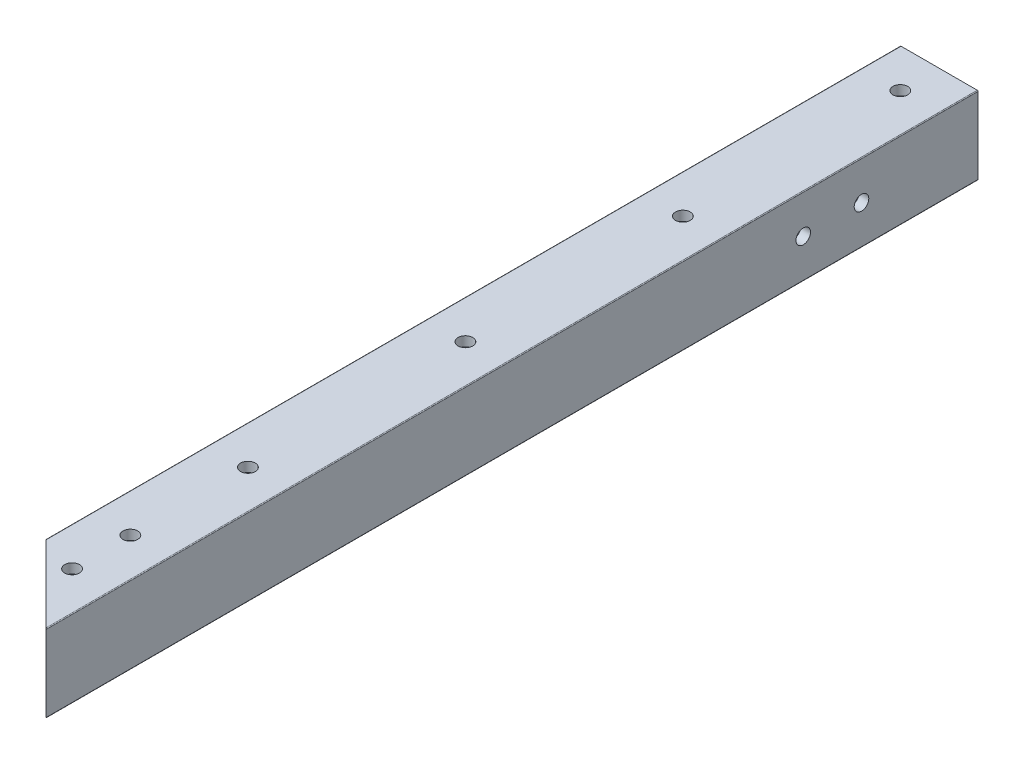
from build123d import *

# Parameters (mm, degrees)
CUT_EXTRUDE1_START = 1524
CUT_EXTRUDE1_DEPTH = 304.8
CUT_EXTRUDE2_START = -25.4
CUT_EXTRUDE2_DEPTH = 25.4
SKETCH3_R          = 2.413
CUT_EXTRUDE3_DEPTH = 1830.152743759
SKETCH4_R          = 2.413
CUT_EXTRUDE4_DEPTH = 1830.152743759
CUT_EXTRUDE5_REACH = 1831.153
SKETCH5_R          = 2.38125
CUT_EXTRUDE6_REACH = 1831.153
SKETCH6_R          = 2.38125


with BuildPart() as part:
    # Cut-Extrude1: read off the stored shape, not the designer's step
    # Cut-Extrude1 outline → Cut-Extrude1 (new body)
    with BuildSketch(Plane.XY.offset(CUT_EXTRUDE1_START)):
        with BuildLine():
            Line((0, 25.146), (0, 0.254))
            ThreePointArc((0, 0.254), (0.074394878, 0.074394878), (0.254, 0))
            Line((0.254, 0), (25.146, 0))
            ThreePointArc((25.146, 0), (25.325605122, 0.074394878), (25.4, 0.254))
            Line((25.4, 0.254), (25.4, 25.146))
            ThreePointArc((25.4, 25.146), (25.325605122, 25.325605122), (25.146, 25.4))
            Line((25.146, 25.4), (0.254, 25.4))
            ThreePointArc((0.254, 25.4), (0.074394878, 25.325605122), (0, 25.146))
        make_face()
        with BuildLine():
            ThreePointArc((4.7625, 3.175), (3.639967985, 3.639967985), (3.175, 4.7625))
            Line((3.175, 4.7625), (3.175, 20.6375))
            ThreePointArc((3.175, 20.6375), (3.639967985, 21.760032015), (4.7625, 22.225))
            Line((4.7625, 22.225), (20.6375, 22.225))
            ThreePointArc((20.6375, 22.225), (21.760032015, 21.760032015), (22.225, 20.6375))
            Line((22.225, 20.6375), (22.225, 4.7625))
            ThreePointArc((22.225, 4.7625), (21.760032015, 3.639967985), (20.6375, 3.175))
            Line((20.6375, 3.175), (4.7625, 3.175))
        make_face(mode=Mode.SUBTRACT)
    extrude(amount=CUT_EXTRUDE1_DEPTH)

    # Sketch2 → Cut-Extrude2 (cut)
    with BuildSketch(Plane(origin=(0, 25.4, 0), x_dir=(1, 0, 0), z_dir=(0, 1, 0)).offset(CUT_EXTRUDE2_START)):
        Polygon((-15.751867444, -1787.648132556), (56.090181524, -1859.490181524), (20.16915704, -1895.411206008), (-51.672891929, -1823.56915704), align=None)
    extrude(amount=CUT_EXTRUDE2_DEPTH, mode=Mode.SUBTRACT)

    # Sketch3 → Cut-Extrude3 (cut, through all)
    with BuildSketch(Plane.XZ):
        with Locations(Location((12.7, 1536.7, 0), (0, 0, 270))):
            Circle(SKETCH3_R)
        with Locations(Location((12.7, 1607.82, 0), (0, 0, 270))):
            Circle(SKETCH3_R)
        with Locations(Location((12.7, 1678.94, 0), (0, 0, 270))):
            Circle(SKETCH3_R)
        with Locations(Location((12.7, 1750.06, 0), (0, 0, 270))):
            Circle(SKETCH3_R)
    extrude(amount=-CUT_EXTRUDE3_DEPTH, mode=Mode.SUBTRACT)

    # Sketch4 → Cut-Extrude4 (cut, through all)
    with BuildSketch(Plane(origin=(0, 25.4, 0), x_dir=(1, 0, 0), z_dir=(0, 1, 0))):
        with Locations(Location((12.7, -1807.571024484, 0), (0, 0, 270))):
            Circle(SKETCH4_R)
        with Locations(Location((12.7, -1788.521024484, 0), (0, 0, 270))):
            Circle(SKETCH4_R)
    extrude(amount=-CUT_EXTRUDE4_DEPTH, mode=Mode.SUBTRACT)

    # Sketch5 → Cut-Extrude5 (cut, up to next)
    with BuildSketch(Plane.ZY, mode=Mode.PRIVATE) as cut_extrude5_sk1:
        with Locations((1536.7, 12.7)):
            Circle(SKETCH5_R)
    cut_extrude5_tool1 = extrude(cut_extrude5_sk1.sketch, amount=-CUT_EXTRUDE5_REACH, mode=Mode.PRIVATE) & part.part
    # Sketch5 → Cut-Extrude5 (cut, up to next)
    with BuildSketch(Plane.ZY, mode=Mode.PRIVATE) as cut_extrude5_sk2:
        with Locations((1549.4, 12.7)):
            Circle(SKETCH5_R)
    cut_extrude5_tool2 = extrude(cut_extrude5_sk2.sketch, amount=-CUT_EXTRUDE5_REACH, mode=Mode.PRIVATE) & part.part
    # Sketch5 → Cut-Extrude5 (cut, up to next)
    with BuildSketch(Plane.ZY, mode=Mode.PRIVATE) as cut_extrude5_sk3:
        with Locations((1562.1, 12.7)):
            Circle(SKETCH5_R)
    cut_extrude5_tool3 = extrude(cut_extrude5_sk3.sketch, amount=-CUT_EXTRUDE5_REACH, mode=Mode.PRIVATE) & part.part
    # Sketch5 → Cut-Extrude5 (cut, up to next)
    with BuildSketch(Plane.ZY, mode=Mode.PRIVATE) as cut_extrude5_sk4:
        with Locations((1574.8, 12.7)):
            Circle(SKETCH5_R)
    cut_extrude5_tool4 = extrude(cut_extrude5_sk4.sketch, amount=-CUT_EXTRUDE5_REACH, mode=Mode.PRIVATE) & part.part
    # Sketch5 → Cut-Extrude5 (cut, up to next)
    with BuildSketch(Plane.ZY, mode=Mode.PRIVATE) as cut_extrude5_sk5:
        with Locations((1587.5, 12.7)):
            Circle(SKETCH5_R)
    cut_extrude5_tool5 = extrude(cut_extrude5_sk5.sketch, amount=-CUT_EXTRUDE5_REACH, mode=Mode.PRIVATE) & part.part
    add(cut_extrude5_tool1.solids().sort_by_distance((0, 12.7, 1536.7))[0], mode=Mode.SUBTRACT)
    add(cut_extrude5_tool2.solids().sort_by_distance((0, 12.7, 1549.4))[0], mode=Mode.SUBTRACT)
    add(cut_extrude5_tool3.solids().sort_by_distance((0, 12.7, 1562.1))[0], mode=Mode.SUBTRACT)
    add(cut_extrude5_tool4.solids().sort_by_distance((0, 12.7, 1574.8))[0], mode=Mode.SUBTRACT)
    add(cut_extrude5_tool5.solids().sort_by_distance((0, 12.7, 1587.5))[0], mode=Mode.SUBTRACT)

    # Sketch6 → Cut-Extrude6 (cut, up to next)
    with BuildSketch(Plane(origin=(25.4, 0, 0), x_dir=(0, 0, -1), z_dir=(1, 0, 0)), mode=Mode.PRIVATE) as cut_extrude6_sk1:
        with Locations(Location((-1562.1, 12.7, 0), (0, 0, 180))):
            Circle(SKETCH6_R)
    cut_extrude6_tool1 = extrude(cut_extrude6_sk1.sketch, amount=-CUT_EXTRUDE6_REACH, mode=Mode.PRIVATE) & part.part
    # Sketch6 → Cut-Extrude6 (cut, up to next)
    with BuildSketch(Plane(origin=(25.4, 0, 0), x_dir=(0, 0, -1), z_dir=(1, 0, 0)), mode=Mode.PRIVATE) as cut_extrude6_sk2:
        with Locations((-1581.15, 12.7)):
            Circle(SKETCH6_R)
    cut_extrude6_tool2 = extrude(cut_extrude6_sk2.sketch, amount=-CUT_EXTRUDE6_REACH, mode=Mode.PRIVATE) & part.part
    add(cut_extrude6_tool1.solids().sort_by_distance((25.4, 12.7, 1562.1))[0], mode=Mode.SUBTRACT)
    add(cut_extrude6_tool2.solids().sort_by_distance((25.4, 12.7, 1581.15))[0], mode=Mode.SUBTRACT)


solid = part.part
